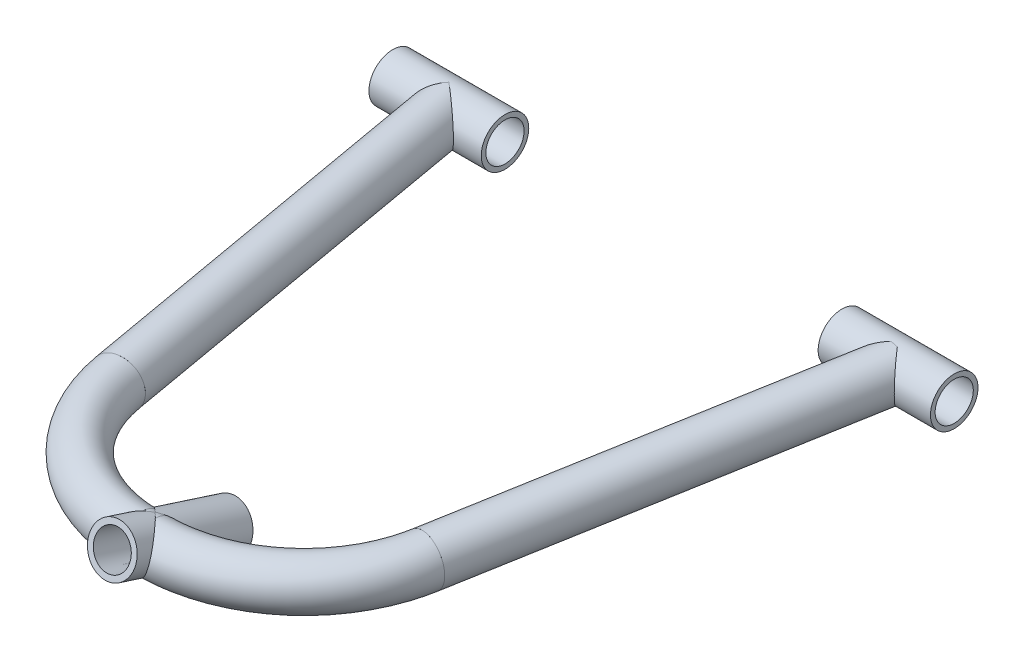
from build123d import *

# Parameters (mm, degrees)
AL_START                                       = -169.337399118
AL_ROUND_TUBING_25_4MM_OD_2_5MM_WALL_2_R       = 12.7
AL_ROUND_TUBING_25_4MM_OD_2_5MM_WALL_2_R_2     = 10.2
AL_ROUND_TUBING_25_4MM_OD_2_5MM_WALL_THI_DEPTH = 215.815587893
AL_ROUND_TUBING_25_4MM_OD_2_5MM_WALL_3_O_R     = 12.7
AL_ROUND_TUBING_25_4MM_OD_2_5MM_WALL_3_O_R_2   = 10.2
AL_ROUND_TUBING_25_4MM_OD_2_5MM_WALL_3_ANGLE   = 80
AL_START_2                                     = 156.642187893
AL_ROUND_TUBING_25_4MM_OD_2_5MM_WALL_4_O_R     = 12.7
AL_ROUND_TUBING_25_4MM_OD_2_5MM_WALL_4_O_R_2   = 10.2
AL_ROUND_TUBING_25_4MM_OD_2_5MM_WALL_4_DEPTH   = 6.733880298
AL_ROUND_TUBING_25_4MM_OD_2_5MM_WALL_5_O_R     = 12.7
AL_ROUND_TUBING_25_4MM_OD_2_5MM_WALL_5_O_R_2   = 10.2
AL_ROUND_TUBING_25_4MM_OD_2_5MM_WALL_5_ANGLE   = 80
AL_START_3                                     = 6.947512144
AL_ROUND_TUBING_25_4MM_OD_2_5MM_WALL_6_O_R     = 12.7
AL_ROUND_TUBING_25_4MM_OD_2_5MM_WALL_6_O_R_2   = 10.2
AL_ROUND_TUBING_25_4MM_OD_2_5MM_WALL_6_DEPTH   = 217.960474667
AL_START_4                                     = 27
AL_ROUND_TUBING_25_4MM_OD_2_5MM_WALL_7_DEPTH   = 29
AL_START_5                                     = 250.00912844
AL_ROUND_TUBING_25_4MM_OD_2_5MM_WALL_8_O_R     = 12.7
AL_ROUND_TUBING_25_4MM_OD_2_5MM_WALL_8_O_R_2   = 10.2
AL_ROUND_TUBING_25_4MM_OD_2_5MM_WALL_8_DEPTH   = 60
AL_START_6                                     = 10.00912844
AL_ROUND_TUBING_25_4MM_OD_2_5MM_WALL_9_O_R     = 12.7
AL_ROUND_TUBING_25_4MM_OD_2_5MM_WALL_9_O_R_2   = 10.2
AL_ROUND_TUBING_25_4MM_OD_2_5MM_WALL_9_DEPTH   = 60
SKETCH1_R                                      = 12.7
SKETCH1_R_2                                    = 9.7
AL_ROUND_TUBING_25_4MM_OD_3MM_WALL_THICK_DEPTH = 65
SKETCH111_R                                    = 9.7
CUT_EXTRUDE1_DEPTH                             = 79
SKETCH112_R                                    = 12.7
CUT_EXTRUDE2_DEPTH                             = 79
SKETCH113_R                                    = 10.7
CUT_EXTRUDE3_DEPTH                             = 79
SKETCH114_R                                    = 12.7
CUT_EXTRUDE4_DEPTH                             = 79


with BuildPart() as part:
    # Al round tubing 25.4MM_OD_2.5MM_WALL_THICKNESS(1): read off the stored shape, not the designer's step
    # Al round tubing 25.4MM_OD_2.5MM_WALL 2 → Al round tubing 25.4MM_OD_2.5MM_WALL_THICKNESS(1) (new body)
    with BuildSketch(Plane(origin=(0, 0, 0), x_dir=(0.9848077523877098, 0, 0.17364818120863598), z_dir=(0.17364818120863598, 0, -0.9848077523877098)).offset(AL_START)):
        with Locations((275.755160427, 0)):
            Circle(AL_ROUND_TUBING_25_4MM_OD_2_5MM_WALL_2_R)
        with Locations((275.755160427, 0)):
            Circle(AL_ROUND_TUBING_25_4MM_OD_2_5MM_WALL_2_R_2, mode=Mode.SUBTRACT)
    extrude(amount=AL_ROUND_TUBING_25_4MM_OD_2_5MM_WALL_THI_DEPTH)

    # Sketch113 → Cut-Extrude3 (cut)
    with BuildSketch(Plane(origin=(310.00912844, 0, 0), x_dir=(0, 0, -1), z_dir=(1, 0, 0))):
        Circle(SKETCH113_R)
    extrude(amount=-CUT_EXTRUDE3_DEPTH, mode=Mode.SUBTRACT)

    # Sketch114 → Cut-Extrude4 (cut)
    with BuildSketch(Plane(origin=(310.00912844, 0, 0), x_dir=(0, 0, -1), z_dir=(1, 0, 0))):
        Circle(SKETCH114_R)
    extrude(amount=-CUT_EXTRUDE4_DEPTH, mode=Mode.SUBTRACT)


with BuildPart() as body_2:
    # Al round tubing 25.4MM_OD_2.5MM_WALL 3 o → Al round tubing 25.4MM_OD_2.5MM_WALL 3 (revolve)
    with BuildSketch(Plane(origin=(163.376068191, 0, 200.757310991), x_dir=(0, 0, 1), z_dir=(-1, 0, 0))):
        with Locations((80, 0)):
            Circle(AL_ROUND_TUBING_25_4MM_OD_2_5MM_WALL_3_O_R)
        with Locations((80, 0)):
            Circle(AL_ROUND_TUBING_25_4MM_OD_2_5MM_WALL_3_O_R_2, mode=Mode.SUBTRACT)
    revolve(axis=Axis((163.376068191, 0, 200.757310991), (0, 1, 0)), revolution_arc=AL_ROUND_TUBING_25_4MM_OD_2_5MM_WALL_3_ANGLE)


with BuildPart() as body_3:
    # Al round tubing 25.4MM_OD_2.5MM_WALL 4 o → Al round tubing 25.4MM_OD_2.5MM_WALL 4 (new body)
    with BuildSketch(Plane.YZ.offset(AL_START_2)):
        with Locations((0, 280.757310991)):
            Circle(AL_ROUND_TUBING_25_4MM_OD_2_5MM_WALL_4_O_R)
        with Locations((0, 280.757310991)):
            Circle(AL_ROUND_TUBING_25_4MM_OD_2_5MM_WALL_4_O_R_2, mode=Mode.SUBTRACT)
    extrude(amount=AL_ROUND_TUBING_25_4MM_OD_2_5MM_WALL_4_DEPTH)


with BuildPart() as body_4:
    # Al round tubing 25.4MM_OD_2.5MM_WALL 5 o → Al round tubing 25.4MM_OD_2.5MM_WALL 5 (revolve)
    with BuildSketch(Plane(origin=(156.642187893, 0, 200.757310991), x_dir=(-0.9848077530122088, 0, 0.1736481776669259), z_dir=(-0.1736481776669259, 0, -0.9848077530122088))):
        with Locations((80, 0)):
            Circle(AL_ROUND_TUBING_25_4MM_OD_2_5MM_WALL_5_O_R)
        with Locations((80, 0)):
            Circle(AL_ROUND_TUBING_25_4MM_OD_2_5MM_WALL_5_O_R_2, mode=Mode.SUBTRACT)
    revolve(axis=Axis((156.642187893, 0, 200.757310991), (0, 1, 0)), revolution_arc=AL_ROUND_TUBING_25_4MM_OD_2_5MM_WALL_5_ANGLE)


with BuildPart() as body_5:
    # Al round tubing 25.4MM_OD_2.5MM_WALL 6 o → Al round tubing 25.4MM_OD_2.5MM_WALL 6 (new body)
    with BuildSketch(Plane(origin=(0, 0, 0), x_dir=(0.9848077530122086, 0, -0.173648177666927), z_dir=(0.17364817766692697, 0, 0.9848077530122088)).offset(AL_START_3)):
        with Locations((39.401299879, 0)):
            Circle(AL_ROUND_TUBING_25_4MM_OD_2_5MM_WALL_6_O_R)
        with Locations((39.401299879, 0)):
            Circle(AL_ROUND_TUBING_25_4MM_OD_2_5MM_WALL_6_O_R_2, mode=Mode.SUBTRACT)
    extrude(amount=AL_ROUND_TUBING_25_4MM_OD_2_5MM_WALL_6_DEPTH)

    # Al round tubing 25.4MM_OD_2.5MM_WALL 7 o → Al round tubing 25.4MM_OD_2.5MM_WALL 7 (cut)
    with BuildSketch(Plane.YZ.offset(AL_START_4)):
        with BuildLine():
            ThreePointArc((12.7, 0), (0, 12.7), (-12.7, 0))
            Line((-12.7, 0), (-12.7, -4))
            Line((-12.7, -4), (12.7, -4))
            Line((12.7, -4), (12.7, 0))
        make_face()
    extrude(amount=AL_ROUND_TUBING_25_4MM_OD_2_5MM_WALL_7_DEPTH, mode=Mode.SUBTRACT)


with BuildPart() as body_6:
    # Al round tubing 25.4MM_OD_2.5MM_WALL 8 o → Al round tubing 25.4MM_OD_2.5MM_WALL 8 (new body)
    with BuildSketch(Plane.YZ.offset(AL_START_5)):
        Circle(AL_ROUND_TUBING_25_4MM_OD_2_5MM_WALL_8_O_R)
        Circle(AL_ROUND_TUBING_25_4MM_OD_2_5MM_WALL_8_O_R_2, mode=Mode.SUBTRACT)
    extrude(amount=AL_ROUND_TUBING_25_4MM_OD_2_5MM_WALL_8_DEPTH)


with BuildPart() as body_7:
    # Al round tubing 25.4MM_OD_2.5MM_WALL 9 o → Al round tubing 25.4MM_OD_2.5MM_WALL 9 (new body)
    with BuildSketch(Plane.YZ.offset(AL_START_6)):
        Circle(AL_ROUND_TUBING_25_4MM_OD_2_5MM_WALL_9_O_R)
        Circle(AL_ROUND_TUBING_25_4MM_OD_2_5MM_WALL_9_O_R_2, mode=Mode.SUBTRACT)
    extrude(amount=AL_ROUND_TUBING_25_4MM_OD_2_5MM_WALL_9_DEPTH)


with BuildPart() as body_8:
    # Sketch1 → Al round tubing 25.4MM_OD_3MM_WALL_THICKNESS(2) (new body)
    with BuildSketch(Plane(origin=(160.00912844, 6.133072583, 299.793734518), x_dir=(1, 0, 0), z_dir=(0, -0.3066536291337132, -0.9518211763451805))):
        Circle(SKETCH1_R)
        Circle(SKETCH1_R_2, mode=Mode.SUBTRACT)
    extrude(amount=AL_ROUND_TUBING_25_4MM_OD_3MM_WALL_THICK_DEPTH)


with BuildPart() as cut_extrude1_tool:
    # Sketch111 → Cut-Extrude1 (new body)
    with BuildSketch(Plane(origin=(0, 88.080353118, 273.392314169), x_dir=(1, 0, 0), z_dir=(0, 0.3066536291337132, 0.9518211763451805))):
        with Locations(Location((160.00912844, -86.095248321, 0), (0, 0, 90))):
            Circle(SKETCH111_R)
    extrude(amount=-CUT_EXTRUDE1_DEPTH)


with BuildPart() as body_2_1:
    add(body_2.part)

    # Cut-Extrude1: cut by cut_extrude1_tool
    add(cut_extrude1_tool.part, mode=Mode.SUBTRACT)


with BuildPart() as body_3_1:
    add(body_3.part)

    # Cut-Extrude1: cut by cut_extrude1_tool
    add(cut_extrude1_tool.part, mode=Mode.SUBTRACT)


with BuildPart() as body_4_1:
    add(body_4.part)

    # Cut-Extrude1: cut by cut_extrude1_tool
    add(cut_extrude1_tool.part, mode=Mode.SUBTRACT)


with BuildPart() as cut_extrude2_tool:
    # Sketch112 → Cut-Extrude2 (new body)
    with BuildSketch(Plane(origin=(0, 88.080353118, 273.392314169), x_dir=(1, 0, 0), z_dir=(0, 0.3066536291337132, 0.9518211763451805))):
        with Locations(Location((160.00912844, -86.095248321, 0), (0, 0, 90))):
            Circle(SKETCH112_R)
    extrude(amount=-CUT_EXTRUDE2_DEPTH)


with BuildPart() as body_2_2:
    add(body_2_1.part)

    # Cut-Extrude2: cut by cut_extrude2_tool
    add(cut_extrude2_tool.part, mode=Mode.SUBTRACT)


with BuildPart() as body_4_2:
    add(body_4_1.part)

    # Cut-Extrude2: cut by cut_extrude2_tool
    add(cut_extrude2_tool.part, mode=Mode.SUBTRACT)


solid = Compound([part.part, body_5.part, body_6.part, body_7.part, body_8.part, body_3_1.part, body_2_2.part, body_4_2.part])
